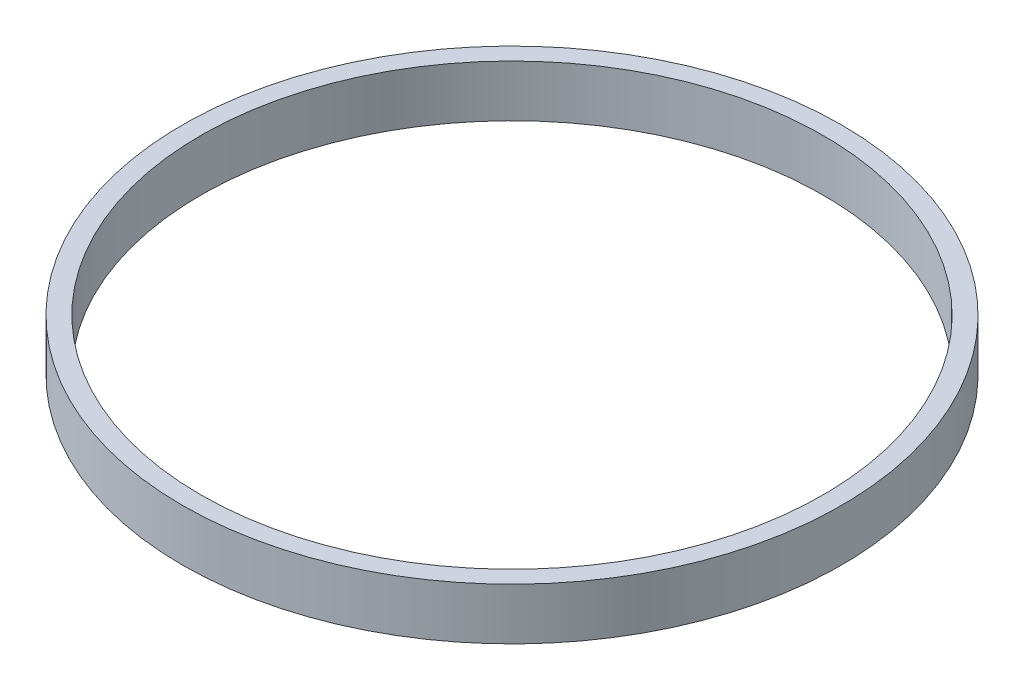
from build123d import *

# Parameters (mm, degrees)
SKETCH2_R           = 36
SKETCH2_R_2         = 34
BOSS_EXTRUDE1_DEPTH = 5.65


with BuildPart() as part:
    # Sketch2 → Boss-Extrude1 (new body)
    with BuildSketch(Plane(origin=(0, 0, 0), x_dir=(1, 0, 0), z_dir=(0, 1, 0))):
        Circle(SKETCH2_R)
        Circle(SKETCH2_R_2, mode=Mode.SUBTRACT)
    extrude(amount=BOSS_EXTRUDE1_DEPTH)


solid = part.part
